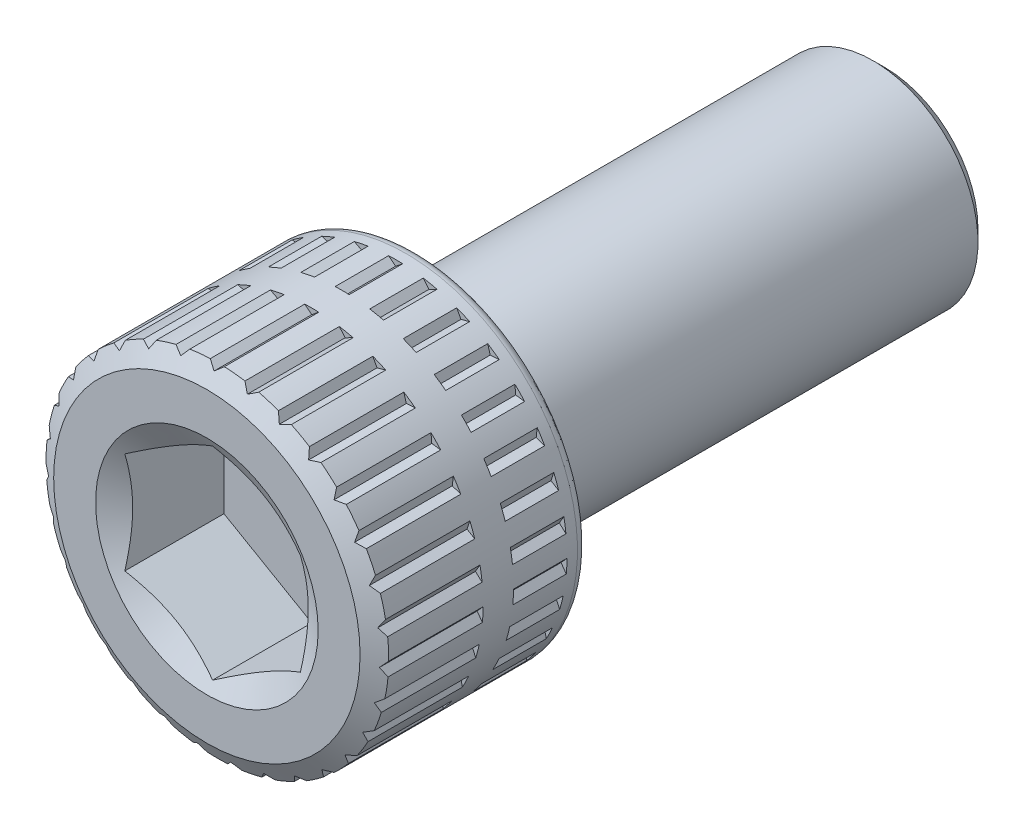
from build123d import *

# Parameters (mm, degrees)
CUT_EXTRUDE1_START = 4.5974
CUT_EXTRUDE1_DEPTH = 1.4224
CHAMFER1_SIZE      = 0.14224
CHAMFER1_SIZE_2    = 0.246366907
CUT_EXTRUDE3_START = -0.725424
CUT_EXTRUDE3_DEPTH = 0.725424
CUT_EXTRUDE4_START = -1.13792
CUT_EXTRUDE4_DEPTH = 7.266079421
CIRPATTERN1_COUNT  = 31


# Read off the part's stored shape, not the designer's step: DeleteFace1
with BuildPart() as part:
    # Sketch2 → Revolve1 (revolve)
    with BuildSketch(Plane(origin=(0, 0, 0), x_dir=(0, 0, -1), z_dir=(1, 0, 0)), mode=Mode.PRIVATE) as revolve1_sk:
        with BuildLine():
            Line((4.5974, 0), (4.5974, 1.26365))
            Line((4.5974, 1.26365), (4.43865, 1.4224))
            Line((4.43865, 1.4224), (-1.7526, 1.4224))
            Line((-1.7526, 1.4224), (-1.7526, 2.18186))
            ThreePointArc((-1.7526, 2.18186), (-1.794261131, 2.282438869), (-1.89484, 2.3241))
            Line((-1.89484, 2.3241), (-4.45516, 2.3241))
            ThreePointArc((-4.45516, 2.3241), (-4.555738869, 2.282438869), (-4.5974, 2.18186))
            Line((-4.5974, 2.18186), (-4.5974, 0))
            Line((-4.5974, 0), (4.5974, 0))
        make_face()
    revolve(revolve1_sk.sketch.rotate(Axis((0, 0, -4.5974), (0, 0, 1)), 90), axis=Axis((0, 0, -4.5974), (0, 0, 1)))

    # Sketch3 → Cut-Extrude1 (cut)
    with BuildSketch(Plane.XY.offset(CUT_EXTRUDE1_START)):
        Polygon((-1.190625, 0.687407664), (-1.190625, -0.687407664), (0, -1.374815329), (1.190625, -0.687407664), (1.190625, 0.687407664), (0, 1.374815329), align=None)
    extrude(amount=-CUT_EXTRUDE1_DEPTH, mode=Mode.SUBTRACT)

    # Cut-Extrude2 cone 1 section (through the dimple's axis) → Cut-Extrude2 (revolve, cut)
    with BuildSketch(Plane(origin=(0, 0, 4.5974), x_dir=(0, -1, 0), z_dir=(1, 0, 0))):
        Polygon((0, 0), (1.509322774, 0), (0, 0.87140791), align=None)
    revolve(axis=Axis((0, 0, 4.5974), (0, 0, -1)), mode=Mode.SUBTRACT)

    # DeleteFace1 outline → DeleteFace1 (revolve)
    with BuildSketch(Plane.XZ):
        with BuildLine():
            Line((2.3241, 4.5974), (2.18186, 4.5974))
            ThreePointArc((2.18186, 4.5974), (2.282438869, 4.555738869), (2.3241, 4.45516))
            Line((2.3241, 4.45516), (2.3241, 4.5974))
        make_face()
    revolve(axis=Axis((0, 0, 0), (0, 0, 1)))

    # Chamfer1
    # the kernel refuses this chamfer: 0.246366907, 0.14224 mm, written as the material it takes off along each edge
    with BuildSketch(Plane(origin=(0, 0, 4.5974), x_dir=(1, 0, 0), z_dir=(0, -1, 0))) as chamfer1_piece_1:
        Polygon((2.3241, -CHAMFER1_SIZE), (2.3241 - CHAMFER1_SIZE_2, 0), (2.3241, 0), align=None)
    revolve(axis=Axis((0, 0, 4.5974), (0, 0, 1)), mode=Mode.SUBTRACT)

    # Sketch8 → Cut-Extrude3 (cut)
    with BuildSketch(Plane(origin=(0, 0, 2.03708), x_dir=(-1, 0, 0), z_dir=(0, 0, -1)).offset(CUT_EXTRUDE3_START)):
        with BuildLine():
            Line((-0.09525, 2.322147335), (0, 2.245947335))
            Line((0, 2.245947335), (0.09525, 2.322147335))
            ThreePointArc((0.09525, 2.322147335), (0, 2.3241), (-0.09525, 2.322147335))
        make_face()
    cut_extrude3 = extrude(amount=CUT_EXTRUDE3_DEPTH, mode=Mode.SUBTRACT)

    # Sketch8<4> → Cut-Extrude4 (cut, through all)
    with BuildSketch(Plane(origin=(0, 0, 2.03708), x_dir=(-1, 0, 0), z_dir=(0, 0, -1)).offset(CUT_EXTRUDE4_START)):
        with BuildLine():
            Line((-0.09525, 2.322147335), (0, 2.245947335))
            Line((0, 2.245947335), (0.09525, 2.322147335))
            ThreePointArc((0.09525, 2.322147335), (0, 2.3241), (-0.09525, 2.322147335))
        make_face()
    cut_extrude4 = extrude(amount=-CUT_EXTRUDE4_DEPTH, mode=Mode.SUBTRACT)

    # CirPattern1: Cut-Extrude3, Cut-Extrude4 ×31 about axis
    cirpattern1_axis = Axis((0, 0, 0), (0, 0, 1))
    add([cut_extrude3.rotate(cirpattern1_axis, i * 360 / CIRPATTERN1_COUNT) for i in range(1, CIRPATTERN1_COUNT)], mode=Mode.SUBTRACT)
    add([cut_extrude4.rotate(cirpattern1_axis, i * 360 / CIRPATTERN1_COUNT) for i in range(1, CIRPATTERN1_COUNT)], mode=Mode.SUBTRACT)


solid = part.part
